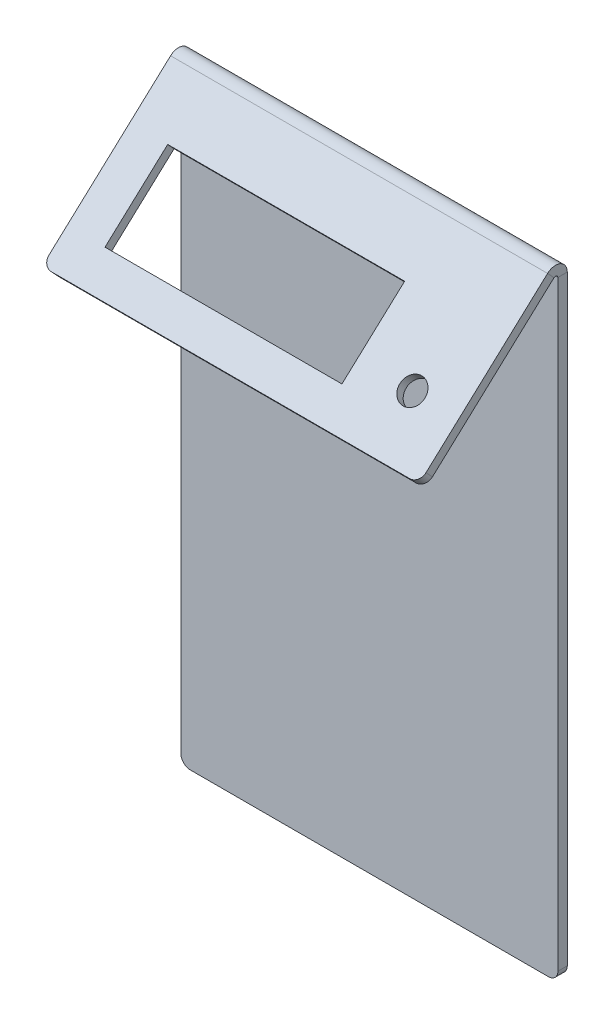
from build123d import *

# Parameters (mm, degrees)
SZKIC1_W                   = 120
SZKIC1_H                   = 200
ODGI_CIE_BAZOWE1_DEPTH     = 3
ODGI_CIE_DOOKOLNE1_DEPTH   = 120
ODGI_CIE_DOOKOLNE1_2_DEPTH = 120
WYTNIJ_WYCI_GNI_CIE1_REACH = 193.554
SZKIC7_R                   = 4
SZKIC7_W                   = 75.41506457
SZKIC7_H                   = 27.105706619
ZAOKR_GLENIE1_R            = 3


# Read off the part's stored shape, not the designer's step: Odgięcie dookolne1
# Sheet-metal steps are written as plain solids
with BuildPart() as part:
    # Szkic1 → Odgięcie bazowe1 (new body)
    with BuildSketch(Plane.XY):
        with Locations((60, 100)):
            Rectangle(SZKIC1_W, SZKIC1_H)
    extrude(amount=-ODGI_CIE_BAZOWE1_DEPTH)

    # Odgięcie dookolne1 outline → Odgięcie dookolne1 (cut)
    with BuildSketch(Plane.YZ):
        with BuildLine():
            Line((200, 0), (197.911617043, 0))
            ThreePointArc((197.911617043, 0), (196.615806823, -2.154295979), (194.248339822, -3))
            Line((194.248339822, -3), (200, -3))
            Line((200, -3), (200, 0))
        make_face()
    extrude(amount=ODGI_CIE_DOOKOLNE1_DEPTH, mode=Mode.SUBTRACT)

    # Odgi_cie dookolne1 2 outline → Odgi_cie dookolne1 2 (add)
    with BuildSketch(Plane.YZ):
        with BuildLine():
            Line((159.401451516, 44.178703704), (157.19251633, 42.14877628))
            Line((157.19251633, 42.14877628), (194.790707041, 1.235014847))
            ThreePointArc((194.790707041, 1.235014847), (194.922769928, 0.440418313), (194.248339822, 0))
            Line((194.248339822, 0), (197.911617043, 0))
            ThreePointArc((197.911617043, 0), (197.847182685, 1.74184107), (196.999642226, 3.264942271))
            Line((196.999642226, 3.264942271), (159.401451516, 44.178703704))
        make_face()
    extrude(amount=ODGI_CIE_DOOKOLNE1_2_DEPTH)

    # Szkic7 → Wytnij-wyciągnięcie1 (cut, up to next)
    with BuildSketch(Plane(origin=(0, 108.430992275, 99.643958017), x_dir=(1, 0, 0), z_dir=(0, 0.7363117283974429, 0.6766424747415508)), mode=Mode.PRIVATE) as wytnij_wyci_gni_cie1_sk1:
        with Locations(Location((105.046682515, 92.762095307, 0), (0, 0, 270))):
            Circle(SZKIC7_R)
    wytnij_wyci_gni_cie1_tool1 = extrude(wytnij_wyci_gni_cie1_sk1.sketch, amount=-WYTNIJ_WYCI_GNI_CIE1_REACH, mode=Mode.PRIVATE) & part.part
    # Szkic7 → Wytnij-wyciągnięcie1 (cut, up to next)
    with BuildSketch(Plane(origin=(0, 108.430992275, 99.643958017), x_dir=(1, 0, 0), z_dir=(0, 0.7363117283974429, 0.6766424747415508)), mode=Mode.PRIVATE) as wytnij_wyci_gni_cie1_sk2:
        with Locations((49.764969339, 99.719590592)):
            Rectangle(SZKIC7_W, SZKIC7_H)
    wytnij_wyci_gni_cie1_tool2 = extrude(wytnij_wyci_gni_cie1_sk2.sketch, amount=-WYTNIJ_WYCI_GNI_CIE1_REACH, mode=Mode.PRIVATE) & part.part
    add(wytnij_wyci_gni_cie1_tool1.solids().sort_by_distance((105.046683, 171.197766, 31.342139))[0], mode=Mode.SUBTRACT)
    add(wytnij_wyci_gni_cie1_tool2.solids().sort_by_distance((49.764969, 175.905503, 26.219254))[0], mode=Mode.SUBTRACT)

    # Zaokrąglenie1
    zaokr_glenie1_edges = [part.edges().sort_by_distance(p)[0] for p in [
        (0, 158.296983923, 43.163739992),
        (120, 158.296983923, 43.163739992),
        (120, 0, -1.5),
        (0, 0, -1.5),
    ]]
    fillet(zaokr_glenie1_edges, radius=ZAOKR_GLENIE1_R)


solid = part.part
